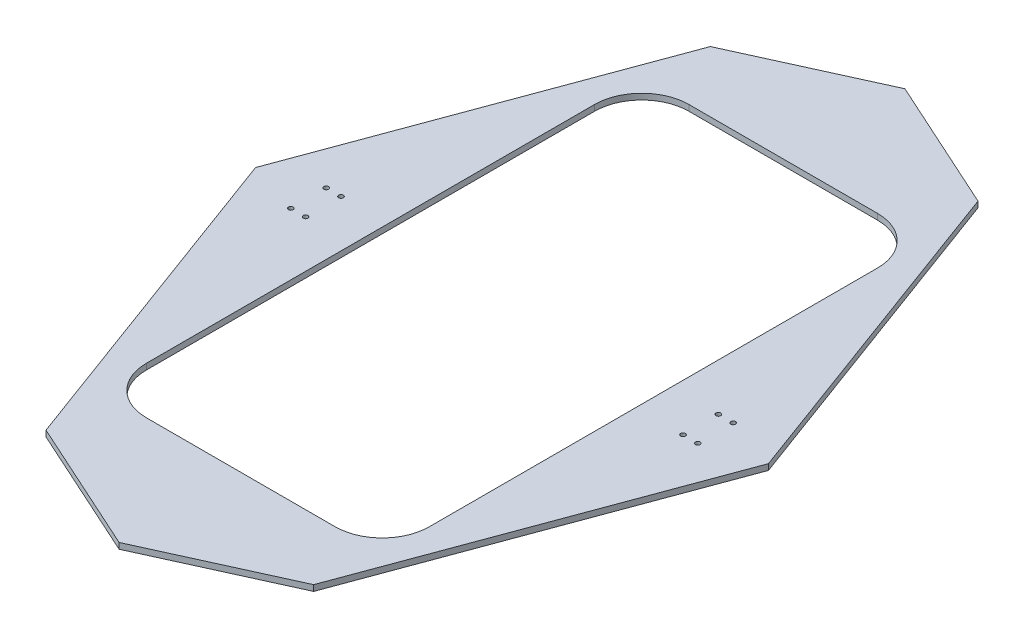
from build123d import *

# Parameters (mm, degrees)
SKETCH1_R           = 2.54
BOSS_EXTRUDE1_DEPTH = 3.175


with BuildPart() as part:
    # Sketch1 → Boss-Extrude1 (new, symmetric)
    with BuildSketch(Plane(origin=(0, 0, 0), x_dir=(1, 0, 0), z_dir=(0, 1, 0))):
        Polygon((-276.108048601, 0), (-144.082731555, -357.661863363), (0, -423.041136678), (144.082731555, -357.661863363), (276.108048601, 0), (144.082731555, 357.661863363), (0, 423.041136678), (-144.082731555, 357.661863363), align=None)
        with Locations((-219.075, -19.05)):
            Circle(SKETCH1_R, mode=Mode.SUBTRACT)
        with Locations((-203.2, -19.05)):
            Circle(SKETCH1_R, mode=Mode.SUBTRACT)
        with Locations((203.2, -19.05)):
            Circle(SKETCH1_R, mode=Mode.SUBTRACT)
        with Locations((219.075, -19.05)):
            Circle(SKETCH1_R, mode=Mode.SUBTRACT)
        with Locations((-219.075, 19.05)):
            Circle(SKETCH1_R, mode=Mode.SUBTRACT)
        with Locations((-203.2, 19.05)):
            Circle(SKETCH1_R, mode=Mode.SUBTRACT)
        with BuildLine():
            ThreePointArc((152.4, -241.3), (137.521024484, -277.221024484), (101.6, -292.1))
            Line((101.6, -292.1), (-101.6, -292.1))
            ThreePointArc((-101.6, -292.1), (-137.521024484, -277.221024484), (-152.4, -241.3))
            Line((-152.4, -241.3), (-152.4, 241.3))
            ThreePointArc((-152.4, 241.3), (-137.521024484, 277.221024484), (-101.6, 292.1))
            Line((-101.6, 292.1), (101.6, 292.1))
            ThreePointArc((101.6, 292.1), (137.521024484, 277.221024484), (152.4, 241.3))
            Line((152.4, 241.3), (152.4, -241.3))
        make_face(mode=Mode.SUBTRACT)
        with Locations((203.2, 19.05)):
            Circle(SKETCH1_R, mode=Mode.SUBTRACT)
        with Locations((219.075, 19.05)):
            Circle(SKETCH1_R, mode=Mode.SUBTRACT)
    extrude(amount=BOSS_EXTRUDE1_DEPTH, both=True)


solid = part.part
